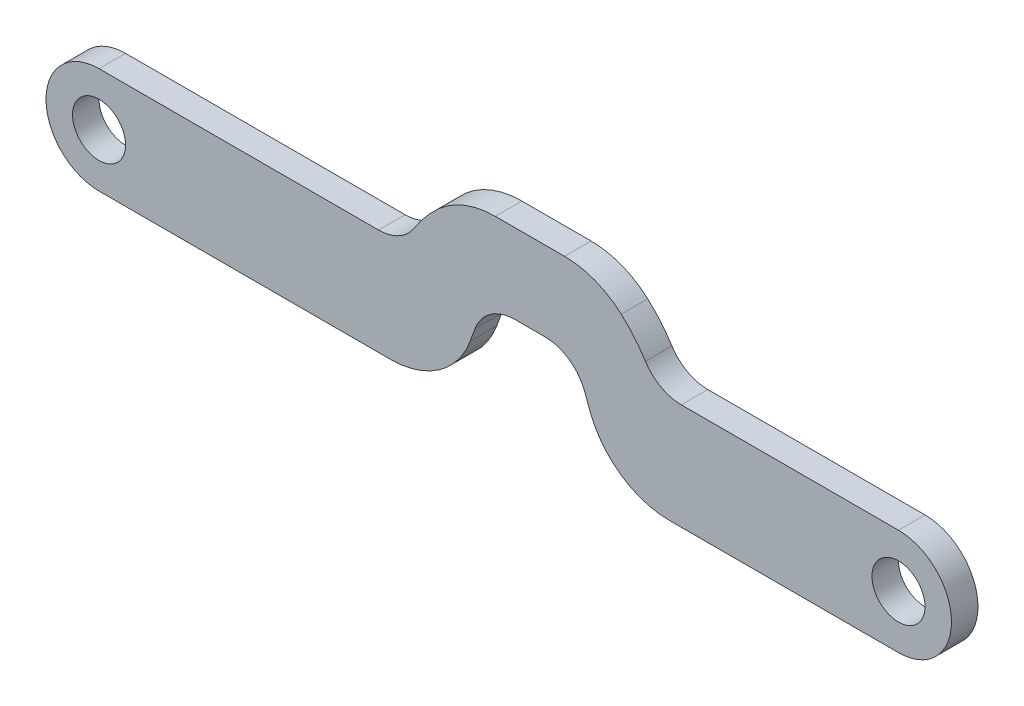
from build123d import *

# Parameters (mm, degrees)
SKETCH_1_R      = 1
EXTRUDE_1_DEPTH = 0.5
EXTRUDE1_DEPTH  = 0.5
EXTRUDE2_DEPTH  = 0.5
FILLET1_R       = 1.6
FILLET2_R       = 3.2


with BuildPart() as part:
    # Эскиз1 → Бобышка-Вытянуть1 (new, symmetric)
    with BuildSketch(Plane.XY):
        with BuildLine():
            Line((0, 2), (-30.1536, 2))
            ThreePointArc((-30.1536, 2), (-32.1536, 0), (-30.1536, -2))
            Line((-30.1536, -2), (0, -2))
            ThreePointArc((0, -2), (2, 0), (0, 2))
        make_face()
        with Locations((-30.1536, 0)):
            Circle(SKETCH_1_R, mode=Mode.SUBTRACT)
        Circle(SKETCH_1_R, mode=Mode.SUBTRACT)
    extrude(amount=EXTRUDE_1_DEPTH, both=True)

    # Sketch2 → Extrude1 (add, symmetric)
    with BuildSketch(Plane.XY):
        with BuildLine():
            Line((-11.879660865, 0.735343308), (-10.884077321, -2))
            Line((-10.884077321, -2), (-9.154212394, -2))
            ThreePointArc((-9.154212394, -2), (-13.9, 5.15), (-18.645787606, -2))
            Line((-18.645787606, -2), (-16.915922679, -2))
            Line((-16.915922679, -2), (-15.920339135, 0.735343308))
            ThreePointArc((-15.920339135, 0.735343308), (-15.659833636, 1.235105491), (-15.278404875, 1.65))
            Line((-15.278404875, 1.65), (-12.521595125, 1.65))
            ThreePointArc((-12.521595125, 1.65), (-12.140166364, 1.235105491), (-11.879660865, 0.735343308))
        make_face()
    extrude(amount=EXTRUDE1_DEPTH, both=True)

    # Sketch → Extrude2 (cut, symmetric)
    with BuildSketch(Plane.XY):
        with BuildLine():
            Line((-10.884077321, -2), (-11.879660865, 0.735343308))
            ThreePointArc((-11.879660865, 0.735343308), (-12.140166364, 1.235105491), (-12.521595125, 1.65))
            Line((-12.521595125, 1.65), (-15.278404875, 1.65))
            ThreePointArc((-15.278404875, 1.65), (-15.659833636, 1.235105491), (-15.920339135, 0.735343308))
            Line((-15.920339135, 0.735343308), (-16.915922679, -2))
            Line((-16.915922679, -2), (-10.884077321, -2))
        make_face()
        with BuildLine():
            ThreePointArc((-11.686405638, 4.65), (-13.9, 5.15), (-16.113594362, 4.65))
            Line((-16.113594362, 4.65), (-11.686405638, 4.65))
        make_face()
    extrude(amount=EXTRUDE2_DEPTH, both=True, mode=Mode.SUBTRACT)

    # Fillet1
    fillet1_edges = [part.edges().sort_by_distance(p)[0] for p in [
        (-9.154212394, 2, 0),
        (-18.645787606, 2, 0),
        (-12.521595125, 1.65, 0),
        (-15.278404875, 1.65, 0),
    ]]
    fillet(fillet1_edges, radius=FILLET1_R)

    # Fillet2
    fillet2_edges = [part.edges().sort_by_distance(p)[0] for p in [
        (-10.884077321, -2, 0),
        (-16.915922679, -2, 0),
        (-11.686405638, 4.65, 0),
        (-16.113594362, 4.65, 0),
    ]]
    fillet(fillet2_edges, radius=FILLET2_R)


solid = part.part
